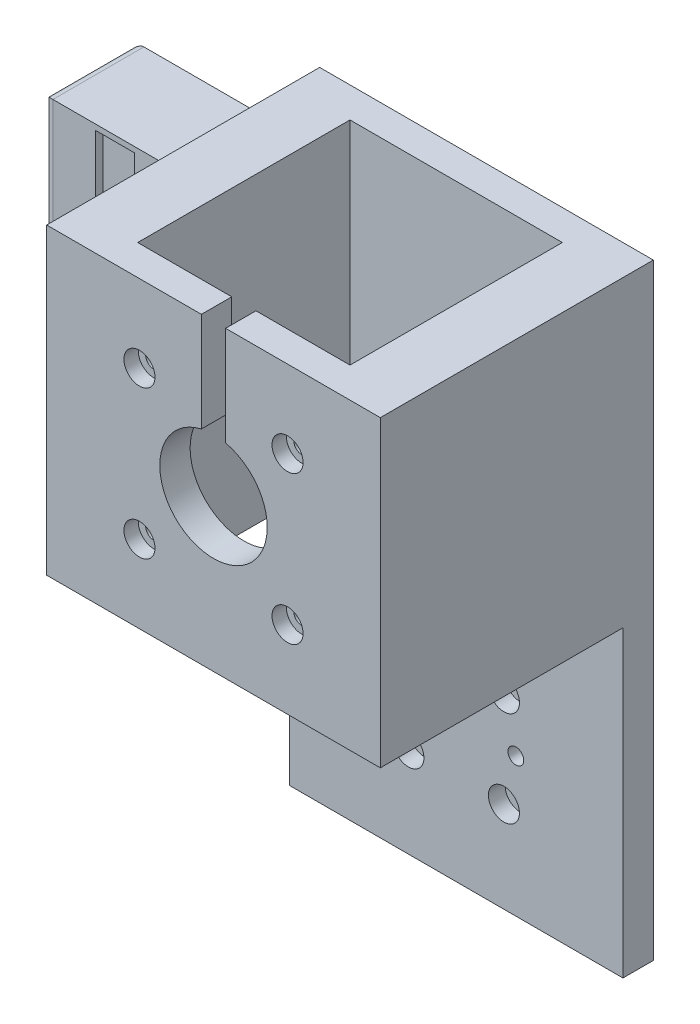
from build123d import *

# Parameters (mm, degrees)
SKETCH4_W                      = 69.85
SKETCH4_H                      = 127
BOSS_EXTRUDE4_DEPTH            = 6.35
CBORE_FOR_M3_SHCS1_D           = 3.4
CBORE_FOR_M3_SHCS1_CBORE_D     = 6.5
CBORE_FOR_M3_SHCS1_CBORE_DEPTH = 3.5
SKETCH7_R                      = 1.651
CUT_EXTRUDE1_DEPTH             = 73.748389157
SKETCH16_W                     = 12.7
SKETCH16_H                     = 63.5
BOSS_EXTRUDE6_DEPTH            = 50.8
SKETCH18_W                     = 6.35
SKETCH18_H                     = 63.5
BOSS_EXTRUDE7_DEPTH            = 44.45
CUT_EXTRUDE3_REACH             = 94.294
SKETCH21_R                     = 11.25
CBORE_START                    = 54.15
CBORE_FOR_M3_SHCS3_OUTLINE_R   = 3.25
CBORE_FOR_M3_SHCS3_DEPTH       = 3
CBORE_START_2                  = 50.8
CBORE_FOR_M3_SHCS3_2_OUTLINE_R = 1.7
CBORE_FOR_M3_SHCS3_2_DEPTH     = 3.35
CBORE_FOR_M3_SHCS3_3_OUTLINE_R = 1.7
CBORE_FOR_M3_SHCS3_3_DEPTH     = 6.35
CUT_EXTRUDE5_REACH             = 94.294
CUT_EXTRUDE6_REACH             = 90.502
SKETCH24_W                     = 42.188209008
SKETCH24_H                     = 6.56852392
SKETCH25_W                     = 19.05
SKETCH25_H                     = 40.64
BOSS_EXTRUDE8_DEPTH            = 35.548437
BOSS_EXTRUDE9_DEPTH            = 5
SKETCH32_W                     = 8.128
SKETCH32_H                     = 38.354
CUT_EXTRUDE8_DEPTH             = 1.524
M3_CLEARANCE_HOLE2_D           = 2.8
FILLET6_R                      = 2.54
FILLET9_R                      = 2
FILLET10_R                     = 2
FILLET11_R                     = 2


# Read off the part's stored shape, not the designer's step: CBORE for M3 SHCS3
with BuildPart() as part:
    # Sketch4 → Boss-Extrude4 (new body)
    with BuildSketch(Plane.XY):
        Rectangle(SKETCH4_W, SKETCH4_H)
    extrude(amount=BOSS_EXTRUDE4_DEPTH)

    # CBORE for M3 SHCS1 (through all)
    with Locations(Plane.XY.offset(6.35)):
        with Locations((-10, -24.45), (10, -44.45), (10, -24.45), (-10, -44.45)):
            CounterBoreHole(CBORE_FOR_M3_SHCS1_D / 2, CBORE_FOR_M3_SHCS1_CBORE_D / 2, CBORE_FOR_M3_SHCS1_CBORE_DEPTH)

    # Sketch7 → Cut-Extrude1 (cut, through all)
    with BuildSketch(Plane.XY.offset(6.35)):
        with Locations((-12.5, -34.45)):
            Circle(SKETCH7_R)
        with Locations((12.5, -34.45)):
            Circle(SKETCH7_R)
    extrude(amount=-CUT_EXTRUDE1_DEPTH, mode=Mode.SUBTRACT)

    # Sketch16 → Boss-Extrude6 (add)
    with BuildSketch(Plane.XY.offset(6.35)):
        with Locations((-28.575, 31.75)):
            Rectangle(SKETCH16_W, SKETCH16_H)
        with Locations((28.575, 31.75)):
            Rectangle(SKETCH16_W, SKETCH16_H)
    extrude(amount=BOSS_EXTRUDE6_DEPTH)

    # Sketch18 → Boss-Extrude7 (add)
    with BuildSketch(Plane(origin=(-22.225, 0, 0), x_dir=(0, 0, -1), z_dir=(1, 0, 0))):
        with Locations((-53.975, 31.75)):
            Rectangle(SKETCH18_W, SKETCH18_H)
    extrude(amount=BOSS_EXTRUDE7_DEPTH)

    # Sketch21 → Cut-Extrude3 (cut, up to next)
    with BuildSketch(Plane.XY.offset(57.15), mode=Mode.PRIVATE) as cut_extrude3_sk1:
        with Locations((0, 31.75)):
            Circle(SKETCH21_R)
    cut_extrude3_tool1 = extrude(cut_extrude3_sk1.sketch, amount=-CUT_EXTRUDE3_REACH, mode=Mode.PRIVATE) & part.part
    add(cut_extrude3_tool1.solids().sort_by_distance((0, 31.75, 57.15))[0], mode=Mode.SUBTRACT)

    # CBORE for M3 SHCS3 outline → CBORE for M3 SHCS3 (cut)
    with BuildSketch(Plane.XY.offset(CBORE_START)):
        with Locations((-15.5, 47.25)):
            Circle(CBORE_FOR_M3_SHCS3_OUTLINE_R)
        with Locations((-15.5, 16.25)):
            Circle(CBORE_FOR_M3_SHCS3_OUTLINE_R)
        with Locations((15.5, 47.25)):
            Circle(CBORE_FOR_M3_SHCS3_OUTLINE_R)
        with Locations((15.5, 16.25)):
            Circle(CBORE_FOR_M3_SHCS3_OUTLINE_R)
    extrude(amount=CBORE_FOR_M3_SHCS3_DEPTH, mode=Mode.SUBTRACT)

    # CBORE for M3 SHCS3 2 outline → CBORE for M3 SHCS3 2 (cut)
    with BuildSketch(Plane.XY.offset(CBORE_START_2)):
        with Locations((-15.5, 47.25)):
            Circle(CBORE_FOR_M3_SHCS3_2_OUTLINE_R)
        with Locations((-15.5, 16.25)):
            Circle(CBORE_FOR_M3_SHCS3_2_OUTLINE_R)
        with Locations((15.5, 47.25)):
            Circle(CBORE_FOR_M3_SHCS3_2_OUTLINE_R)
        with Locations((15.5, 16.25)):
            Circle(CBORE_FOR_M3_SHCS3_2_OUTLINE_R)
    extrude(amount=CBORE_FOR_M3_SHCS3_2_DEPTH, mode=Mode.SUBTRACT)

    # CBORE for M3 SHCS3 3 outline → CBORE for M3 SHCS3 3 (cut)
    with BuildSketch(Plane.XY):
        with Locations((0, 31.75)):
            Circle(CBORE_FOR_M3_SHCS3_3_OUTLINE_R)
    extrude(amount=CBORE_FOR_M3_SHCS3_3_DEPTH, mode=Mode.SUBTRACT)

    # Sketch23 → Cut-Extrude5 (cut, up to next)
    with BuildSketch(Plane.XY.offset(57.15), mode=Mode.PRIVATE) as cut_extrude5_sk1:
        with BuildLine():
            Line((-2.53747066, 36.810770012), (-2.53747066, 63.5))
            ThreePointArc((-2.53747066, 63.5), (0, 66.03747066), (2.53747066, 63.5))
            Line((2.53747066, 63.5), (2.53747066, 36.810770012))
            ThreePointArc((2.53747066, 36.810770012), (0, 34.273299352), (-2.53747066, 36.810770012))
        make_face()
    cut_extrude5_tool1 = extrude(cut_extrude5_sk1.sketch, amount=-CUT_EXTRUDE5_REACH, mode=Mode.PRIVATE) & part.part
    add(cut_extrude5_tool1.solids().sort_by_distance((0, 50.155385, 57.15))[0], mode=Mode.SUBTRACT)

    # Sketch24 → Cut-Extrude6 (cut, up to next)
    with BuildSketch(Plane.XY.offset(6.35), mode=Mode.PRIVATE) as cut_extrude6_sk1:
        Rectangle(SKETCH24_W, SKETCH24_H)
    cut_extrude6_tool1 = extrude(cut_extrude6_sk1.sketch, amount=-CUT_EXTRUDE6_REACH, mode=Mode.PRIVATE) & part.part
    add(cut_extrude6_tool1.solids().sort_by_distance((0, 0, 6.35))[0], mode=Mode.SUBTRACT)

    # Sketch25 → Boss-Extrude8 (add)
    with BuildSketch(Plane.ZY.offset(34.925)):
        with Locations((12.777, 31.75)):
            Rectangle(SKETCH25_W, SKETCH25_H)
    extrude(amount=BOSS_EXTRUDE8_DEPTH)

    # Sketch31 → Boss-Extrude9 (add, symmetric)
    with BuildSketch(Plane(origin=(0, 0, 12.777), x_dir=(-1, 0, 0), z_dir=(0, 0, -1))):
        Polygon((34.925, 11.43), (70.4734375, 11.43), (34.925, 0), align=None)
    extrude(amount=BOSS_EXTRUDE9_DEPTH, both=True)

    # Sketch32 → Cut-Extrude8 (cut)
    with BuildSketch(Plane.XY.offset(22.302)):
        with Locations((-55.4734375, 31.75)):
            Rectangle(SKETCH32_W, SKETCH32_H)
    extrude(amount=-CUT_EXTRUDE8_DEPTH, mode=Mode.SUBTRACT)

    # M3 Clearance Hole2 (through all)
    with Locations(Plane.XY.offset(20.778)):
        with Locations((-55.4734375, 31.75)):
            Hole(M3_CLEARANCE_HOLE2_D / 2)

    # Fillet6
    fillet6_edges = [part.edges().sort_by_distance(p)[0] for p in [
        (-34.925, 11.43, 5.5145),
        (-34.925, 11.43, 20.0395),
        (-52.699218512, 11.43, 17.777),
        (-52.699218512, 11.43, 7.777),
    ]]
    fillet(fillet6_edges, radius=FILLET6_R)

    # Fillet9
    # the kernel refuses this fillet: 2 mm, written as the material it takes off along each edge
    with BuildSketch(Plane(origin=(-70.473437, 57.07, 22.302), x_dir=(0, 0, -1), z_dir=(0, -1, 0)), Plane(origin=(-70.473437, 6.43, 3.252), x_dir=(0, 0, 1), z_dir=(0, 1, 0))) as fillet9_piece_1:
        with BuildLine():
            CenterArc((FILLET9_R, FILLET9_R), FILLET9_R, 180, 90)
            Line((0, FILLET9_R), (0, 0))
            Line((0, 0), (FILLET9_R, 0))
        make_face()
    extrude(amount=50.64, mode=Mode.SUBTRACT)
    with BuildSketch(Plane(origin=(-70.473437, 52.07, -1.748), x_dir=(0, -1, 0), z_dir=(0, 0, 1))) as fillet9_piece_2:
        with BuildLine():
            CenterArc((FILLET9_R, FILLET9_R), FILLET9_R, 180, 90)
            Line((0, FILLET9_R), (0, 0))
            Line((0, 0), (FILLET9_R, 0))
        make_face()
    extrude(amount=29.05, mode=Mode.SUBTRACT)

    # Fillet10
    fillet10_edges = [part.edges().sort_by_distance(p)[0] for p in [
        (-34.925, 52.07, 12.777),
    ]]
    fillet(fillet10_edges, radius=FILLET10_R)

    # Fillet11
    fillet11_edges = [part.edges().sort_by_distance(p)[0] for p in [
        (-34.925, 31.48, 3.252),
        (-34.925, 31.48, 22.302),
    ]]
    fillet(fillet11_edges, radius=FILLET11_R)


solid = part.part
